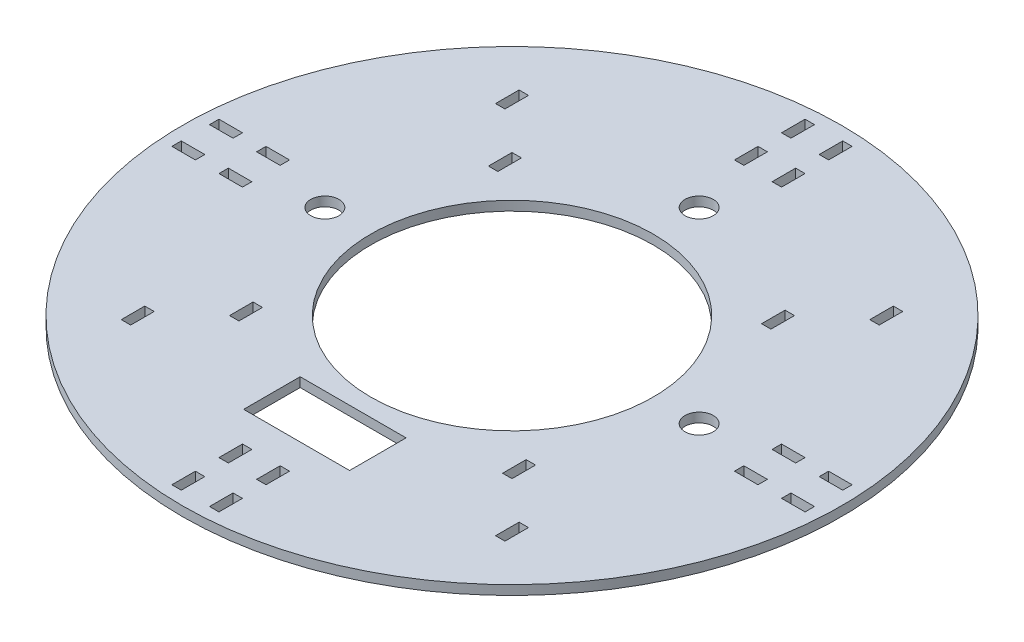
from build123d import *

# Parameters (mm, degrees)
SKETCH1_R                   = 70
SKETCH1_W                   = 2
SKETCH1_H                   = 5
SKETCH1_W_2                 = 5
SKETCH1_H_2                 = 2
SKETCH1_W_3                 = 22.5
SKETCH1_H_3                 = 12
SKETCH1_R_2                 = 3
SKETCH1_R_3                 = 30
Y_KSEKLIK_EKSTR_ZYON1_DEPTH = 2


with BuildPart() as part:
    # Sketch1 → Yükseklik-Ekstrüzyon1 (new body)
    with BuildSketch(Plane(origin=(0, 0, 0), x_dir=(1, 0, 0), z_dir=(0, 1, 0))):
        Circle(SKETCH1_R)
        with Locations((-39.748737342, -39.748737342)):
            Rectangle(SKETCH1_W, SKETCH1_H, mode=Mode.SUBTRACT)
        with Locations((-4, -64.748737342)):
            Rectangle(SKETCH1_W, SKETCH1_H, mode=Mode.SUBTRACT)
        with Locations((-4, -54.748737342)):
            Rectangle(SKETCH1_W, SKETCH1_H, mode=Mode.SUBTRACT)
        with Locations((-64.748737342, -4)):
            Rectangle(SKETCH1_W_2, SKETCH1_H_2, mode=Mode.SUBTRACT)
        with Locations((-54.748737342, -4)):
            Rectangle(SKETCH1_W_2, SKETCH1_H_2, mode=Mode.SUBTRACT)
        with Locations((-29, -27.5)):
            Rectangle(SKETCH1_W, SKETCH1_H, mode=Mode.SUBTRACT)
        with Locations((4, -64.748737342)):
            Rectangle(SKETCH1_W, SKETCH1_H, mode=Mode.SUBTRACT)
        with Locations((4, -54.748737342)):
            Rectangle(SKETCH1_W, SKETCH1_H, mode=Mode.SUBTRACT)
        with Locations((0, -39.748737342)):
            Rectangle(SKETCH1_W_3, SKETCH1_H_3, mode=Mode.SUBTRACT)
        with Locations((39.748737342, -39.748737342)):
            Rectangle(SKETCH1_W, SKETCH1_H, mode=Mode.SUBTRACT)
        with Locations((29, -27.5)):
            Rectangle(SKETCH1_W, SKETCH1_H, mode=Mode.SUBTRACT)
        with Locations((54.748737342, -4)):
            Rectangle(SKETCH1_W_2, SKETCH1_H_2, mode=Mode.SUBTRACT)
        with Locations((64.748737342, -4)):
            Rectangle(SKETCH1_W_2, SKETCH1_H_2, mode=Mode.SUBTRACT)
        with Locations((-64.748737342, 4)):
            Rectangle(SKETCH1_W_2, SKETCH1_H_2, mode=Mode.SUBTRACT)
        with Locations((-54.748737342, 4)):
            Rectangle(SKETCH1_W_2, SKETCH1_H_2, mode=Mode.SUBTRACT)
        with Locations((-39.748737342, 0)):
            Circle(SKETCH1_R_2, mode=Mode.SUBTRACT)
        with Locations((-29, 27.5)):
            Rectangle(SKETCH1_W, SKETCH1_H, mode=Mode.SUBTRACT)
        with Locations((-39.748737342, 39.748737342)):
            Rectangle(SKETCH1_W, SKETCH1_H, mode=Mode.SUBTRACT)
        with Locations((-4, 54.748737342)):
            Rectangle(SKETCH1_W, SKETCH1_H, mode=Mode.SUBTRACT)
        with Locations((-4, 64.748737342)):
            Rectangle(SKETCH1_W, SKETCH1_H, mode=Mode.SUBTRACT)
        Circle(SKETCH1_R_3, mode=Mode.SUBTRACT)
        with Locations((29, 27.5)):
            Rectangle(SKETCH1_W, SKETCH1_H, mode=Mode.SUBTRACT)
        with Locations((39.748737342, 0)):
            Circle(SKETCH1_R_2, mode=Mode.SUBTRACT)
        with Locations((54.748737342, 4)):
            Rectangle(SKETCH1_W_2, SKETCH1_H_2, mode=Mode.SUBTRACT)
        with Locations((64.748737342, 4)):
            Rectangle(SKETCH1_W_2, SKETCH1_H_2, mode=Mode.SUBTRACT)
        with Locations((0, 39.748737342)):
            Circle(SKETCH1_R_2, mode=Mode.SUBTRACT)
        with Locations((4, 54.748737342)):
            Rectangle(SKETCH1_W, SKETCH1_H, mode=Mode.SUBTRACT)
        with Locations((4, 64.748737342)):
            Rectangle(SKETCH1_W, SKETCH1_H, mode=Mode.SUBTRACT)
        with Locations((39.748737342, 39.748737342)):
            Rectangle(SKETCH1_W, SKETCH1_H, mode=Mode.SUBTRACT)
    extrude(amount=Y_KSEKLIK_EKSTR_ZYON1_DEPTH)


solid = part.part
